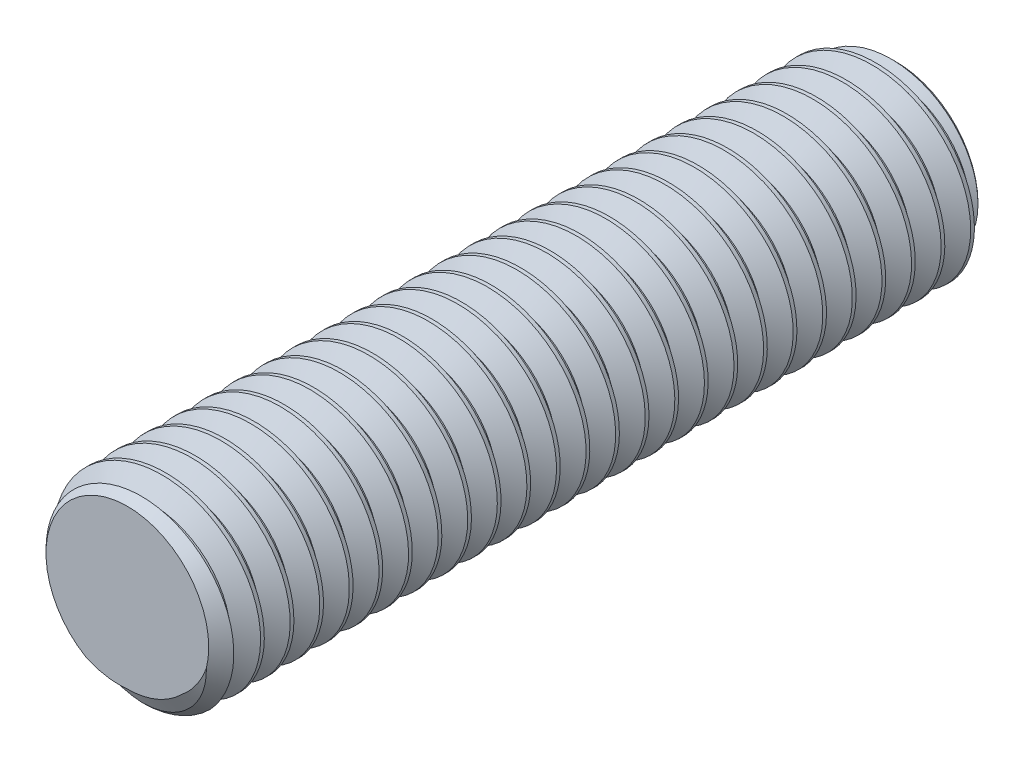
from build123d import *

# Parameters (mm, degrees)
BOSS_EXTRUDE1_DEPTH      = 25.4
BOSS_EXTRUDE1_DEPTH_BACK = 25.4
SKETCH4_R                = 6.35
CHAMFER1_SIZE            = 0.976923077
CUT_SWEEP1_PITCH         = 1.953846154


with BuildPart() as part:
    # Sketch4 → Boss-Extrude1 (new, two sides: drawn at the far end of the back side and taken through both)
    with BuildSketch(Plane.XY.offset(-BOSS_EXTRUDE1_DEPTH_BACK)):
        Circle(SKETCH4_R)
    extrude(amount=BOSS_EXTRUDE1_DEPTH + BOSS_EXTRUDE1_DEPTH_BACK)

    # Chamfer1
    chamfer1_edges = [part.edges().sort_by_distance(p)[0] for p in [
        (-6.35, 0, -25.4),
        (-6.35, 0, 25.4),
    ]]
    chamfer(chamfer1_edges, length=CHAMFER1_SIZE)

    # Cut-Sweep1: arcs per turn and ends read off the stored shape
    # Cut-Sweep1: the profile of Sketch5 screwed along a right-hand helix through 27 turns, 10 arcs to a turn; built about Z, then put on its axis
    cut_sweep1_z = Axis((0, 0, 0), (0, 0, 1))
    cut_sweep1_corners = [(6.455755025, 0, -1.770673077), (6.455755025, 0, 0.061057692), (5.080939697, 0, -0.732692308), (5.080939697, 0, -0.976923077)]
    with BuildLine(mode=Mode.PRIVATE) as cut_sweep1_profile:
        Line(cut_sweep1_corners[0], cut_sweep1_corners[1])
        Line(cut_sweep1_corners[1], cut_sweep1_corners[2])
        Line(cut_sweep1_corners[2], cut_sweep1_corners[3])
        Line(cut_sweep1_corners[3], cut_sweep1_corners[0])
    cut_sweep1_cap = Face(cut_sweep1_profile.wire())
    cut_sweep1_turn_angles = [0, 18, 36, 54, 72, 90, 108, 126, 144, 162, 180, 198, 216, 234, 252, 270, 288, 306, 324, 342, 360]
    cut_sweep1_turn_weights = [1, 0.9510565162951535, 1, 0.9510565162951535, 1, 0.9510565162951535, 1, 0.9510565162951535, 1, 0.9510565162951535, 1, 0.9510565162951535, 1, 0.9510565162951535, 1, 0.9510565162951535, 1, 0.9510565162951535, 1, 0.9510565162951535, 1]
    cut_sweep1_turn_rails = [Edge.make_bspline([Vector(p[0], p[1], 0).rotate(cut_sweep1_z, cut_sweep1_turn_angles[k]) / cut_sweep1_turn_weights[k] + Vector(0, 0, p[2] + CUT_SWEEP1_PITCH * cut_sweep1_turn_angles[k] / 360) for k in range(21)], [0, 0, 0, 1, 1, 2, 2, 3, 3, 4, 4, 5, 5, 6, 6, 7, 7, 8, 8, 9, 9, 10, 10, 10], 2, cut_sweep1_turn_weights) for p in cut_sweep1_corners]
    cut_sweep1_turn_sides = [Face.make_surface_from_curves(cut_sweep1_turn_rails[p[0]], cut_sweep1_turn_rails[p[1]]) for p in [(0, 1), (1, 2), (2, 3), (3, 0)]]
    cut_sweep1 = Plane(origin=(0, 0, 25.4), x_dir=(0, 1, 0), z_dir=(0, 0, -1)) * Solid(Shell([*[p.moved(Location((0, 0, CUT_SWEEP1_PITCH * i))) for i in range(27) for p in cut_sweep1_turn_sides], cut_sweep1_cap, cut_sweep1_cap.rotate(cut_sweep1_z, 9720).moved(Location((0, 0, CUT_SWEEP1_PITCH * 9720 / 360)))]))
    add(cut_sweep1, mode=Mode.SUBTRACT)


solid = part.part
